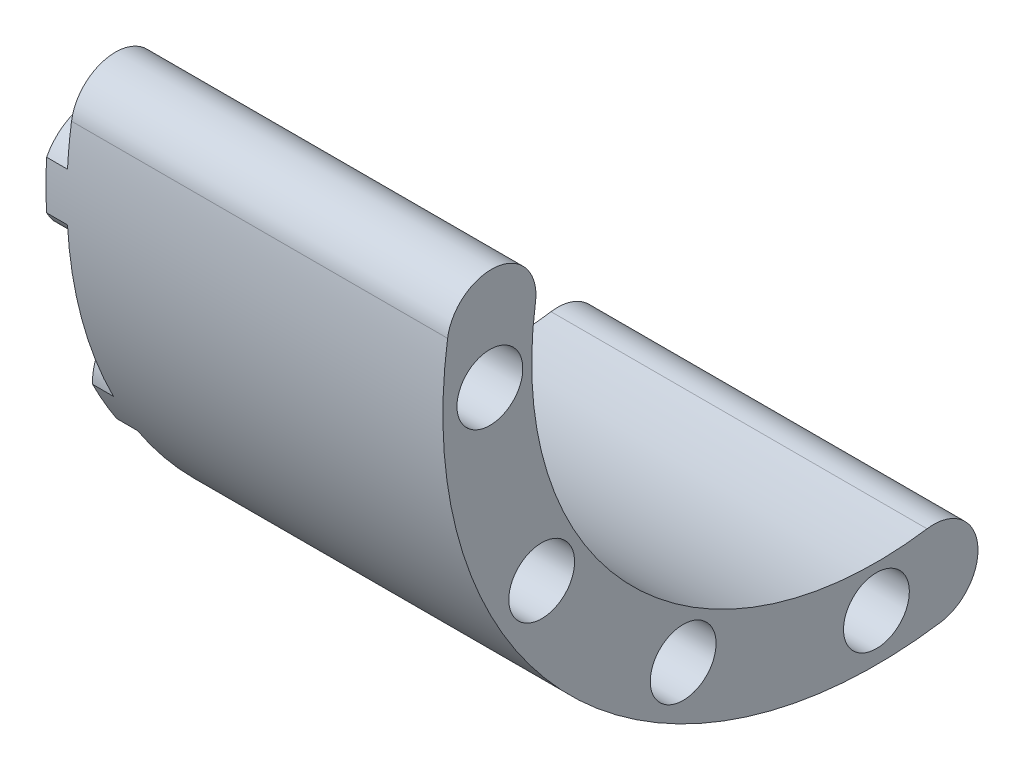
from build123d import *

# Parameters (mm, degrees)
SKETCH_1_R               = 41.5
SKETCH_1_R_2             = 33
EXTRUDE_1_DEPTH          = 38
SKETCH_2_R               = 3.15
CUT_EXTRUDE_1_DEPTH      = 70.91780889
PATTERN_CIRCULAR_1_COUNT = 4
PATTERN_CIRCULAR_1_ANGLE = 90
CUT_EXTRUDE_2_DEPTH      = 38
FILLET_START             = -1
FILLET_1_DEPTH           = 40
FILLET_2_DEPTH           = 38
SKETCH_4_OUTSIDE_W       = 69.583
SKETCH_4_OUTSIDE_H       = 69.583
SKETCH_4_OUTSIDE_R       = 5
CUT_EXTRUDE_3_DEPTH      = 2


with BuildPart() as part:
    # 草图1 → 凸台-拉伸1 (new body)
    with BuildSketch(Plane(origin=(0, 0, 0), x_dir=(0, 0, -1), z_dir=(1, 0, 0))):
        Circle(SKETCH_1_R)
        Circle(SKETCH_1_R_2, mode=Mode.SUBTRACT)
    extrude(amount=EXTRUDE_1_DEPTH)

    # 草图2 → 切除-拉伸1 (cut, through all)
    with BuildSketch(Plane.ZY):
        with Locations((37, 0)):
            Circle(SKETCH_2_R)
    cut_extrude_1 = extrude(amount=-CUT_EXTRUDE_1_DEPTH, mode=Mode.SUBTRACT)

    # 阵列(圆周)1: 切除-拉伸1 ×4 about axis
    pattern_circular_1_axis = Axis((0, 0, 0), (1, 0, 0))
    for i in range(1, PATTERN_CIRCULAR_1_COUNT):
        add(cut_extrude_1.rotate(pattern_circular_1_axis, i * PATTERN_CIRCULAR_1_ANGLE / (PATTERN_CIRCULAR_1_COUNT - 1)), mode=Mode.SUBTRACT)

    # 草图3 → 切除-拉伸2 (cut)
    with BuildSketch(Plane.ZY):
        with BuildLine():
            Line((40.085921791, 10.740990372), (0, 0))
            Line((0, 0), (-10.740990372, -40.085921791))
            ThreePointArc((-10.740990372, -40.085921791), (-29.344931419, 29.344931419), (40.085921791, 10.740990372))
        make_face()
    extrude(amount=-CUT_EXTRUDE_2_DEPTH, mode=Mode.SUBTRACT)

    # 圆角1: read off the stored shape, not the designer's step
    # 圆角1 outline → 圆角1 (cut)
    with BuildSketch(Plane.YZ.offset(FILLET_START)):
        with BuildLine():
            ThreePointArc((10.740990372, 40.085921791), (8.43291814, 40.634171477), (6.097289766, 41.049641381))
            add(Edge.make_bspline(
                [(6.097289766, 41.049641381), (7.224539758, 40.882205817), (8.479546293, 40.316443685), (9.579562271, 39.181662294), (10.053171447, 37.518946615), (9.578053286, 35.745781503)],
                knots=[0, 0, 0, 0, 0, 0, 0.528616925, 0.528616925, 0.528616925, 0.528616925, 0.528616925, 0.528616925], degree=5, weights=[1, 0.78855323, 0.632993631, 0.533321202, 0.489535944, 0.501637857]))
            Line((9.578053286, 35.745781503), (10.740990372, 40.085921791))
        make_face()
        with BuildLine():
            Line((8.541028488, 31.875552268), (9.578053286, 35.745781503))
            add(Edge.make_bspline(
                [(9.578053286, 35.745781503), (9.173304992, 34.235240304), (8.196828695, 33.153640695), (6.985664176, 32.610562324), (5.825288873, 32.496788788), (4.848447284, 32.641883508)],
                knots=[0.528616925, 0.528616925, 0.528616925, 0.528616925, 0.528616925, 0.528616925, 1, 1, 1, 1, 1, 1], degree=5, weights=[0.501637857, 0.512429484, 0.567661512, 0.667333941, 0.81144677, 1]))
            ThreePointArc((4.848447284, 32.641883508), (6.705693943, 32.31150985), (8.541028488, 31.875552268))
        make_face()
    extrude(amount=FILLET_1_DEPTH, mode=Mode.SUBTRACT)

    # 圆角2: read off the stored shape, not the designer's step
    # 圆角2 outline → 圆角2 (cut)
    with BuildSketch(Plane.YZ):
        with BuildLine():
            add(Edge.make_bspline(
                [(-41.049641381, -6.097289766), (-40.882205817, -7.224539758), (-40.316443685, -8.479546293), (-39.181662294, -9.579562271), (-37.518946615, -10.053171446), (-35.745781503, -9.578053286)],
                knots=[0, 0, 0, 0, 0, 0, 0.528616925, 0.528616925, 0.528616925, 0.528616925, 0.528616925, 0.528616925], degree=5, weights=[1, 0.78855323, 0.632993631, 0.533321202, 0.489535944, 0.501637857]))
            ThreePointArc((-41.049641381, -6.097289766), (-40.634171477, -8.43291814), (-40.085921791, -10.740990372))
            Line((-40.085921791, -10.740990372), (-35.745781503, -9.578053286))
        make_face()
        with BuildLine():
            add(Edge.make_bspline(
                [(-35.745781503, -9.578053286), (-34.235240304, -9.173304992), (-33.153640695, -8.196828695), (-32.610562324, -6.985664176), (-32.496788788, -5.825288873), (-32.641883508, -4.848447284)],
                knots=[0.528616925, 0.528616925, 0.528616925, 0.528616925, 0.528616925, 0.528616925, 1, 1, 1, 1, 1, 1], degree=5, weights=[0.501637857, 0.512429484, 0.567661512, 0.667333941, 0.81144677, 1]))
            Line((-35.745781503, -9.578053286), (-31.875552268, -8.541028488))
            ThreePointArc((-31.875552268, -8.541028488), (-32.31150985, -6.705693943), (-32.641883508, -4.848447284))
        make_face()
    extrude(amount=FILLET_2_DEPTH, mode=Mode.SUBTRACT)

    # 草图4 outside → 切除-拉伸3 (cut)
    with BuildSketch(Plane(origin=(0, 0, 0), x_dir=(0, 0, -1), z_dir=(1, 0, 0))):
        with Locations((-15.8885, -15.8885)):
            Rectangle(SKETCH_4_OUTSIDE_W, SKETCH_4_OUTSIDE_H)
        with Locations((-18.5, -32.04293994)):
            Circle(SKETCH_4_OUTSIDE_R, mode=Mode.SUBTRACT)
        with Locations((-37, 0)):
            Circle(SKETCH_4_OUTSIDE_R, mode=Mode.SUBTRACT)
        with Locations((0, -37)):
            Circle(SKETCH_4_OUTSIDE_R, mode=Mode.SUBTRACT)
        with Locations((-32.04293994, -18.5)):
            Circle(SKETCH_4_OUTSIDE_R, mode=Mode.SUBTRACT)
    extrude(amount=CUT_EXTRUDE_3_DEPTH, mode=Mode.SUBTRACT)


solid = part.part
